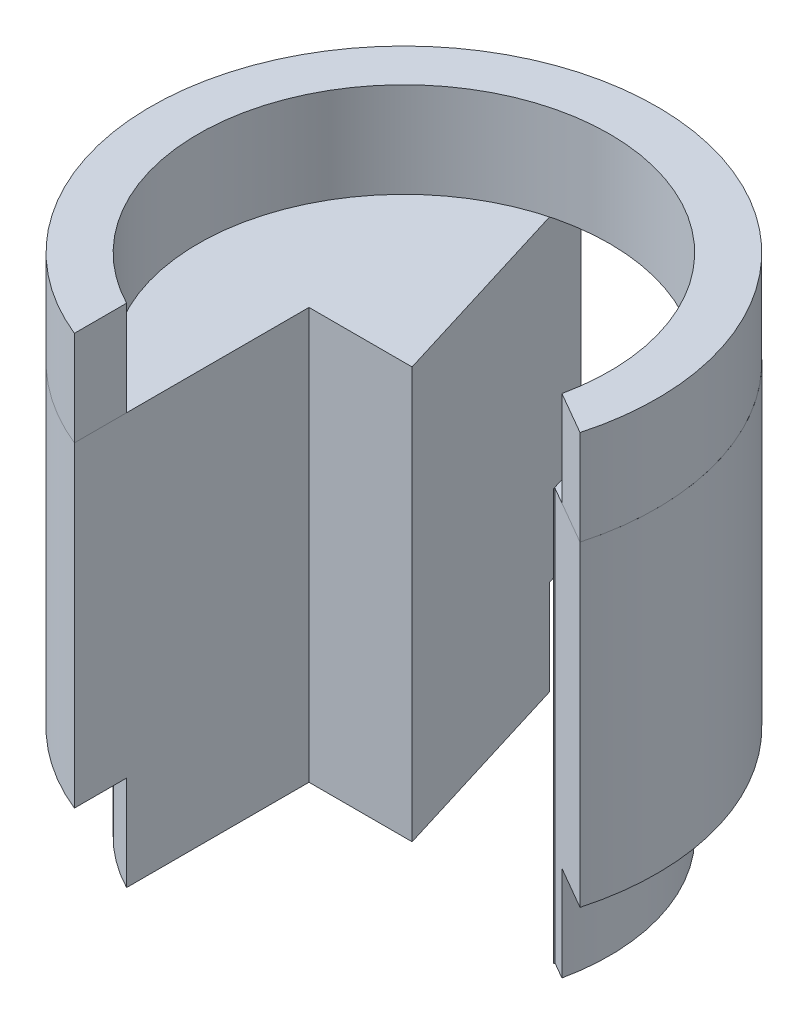
from build123d import *

# Parameters (mm, degrees)
SKETCH2_R               = 101.6
BOSS_EXTRUDE1_DEPTH     = 304.8
SKETCH3_R               = 101.6
SKETCH3_R_2             = 82.55
BOSS_EXTRUDE2_DEPTH     = 38.1
SKETCH4_W               = 76.2
SKETCH4_H               = 101.6
CUT_EXTRUDE1_DEPTH      = 228.6
CUT_EXTRUDE2_START      = -228.6
CUT_EXTRUDE2_DEPTH      = 190.5
SKETCH5_R               = 76.2
CUT_EXTRUDE3_DEPTH      = 25.4
CUT_EXTRUDE4_START      = -228.6
CUT_EXTRUDE4_DEPTH      = 228.6
CUT_EXTRUDE5_DEPTH      = 372.786941675
CUT_EXTRUDE6_DEPTH      = 372.786941675
CUT_EXTRUDE6_DEPTH_BACK = 372.786941675
SKETCH8_W               = 203.2
SKETCH8_H               = 177.8
BOSS_EXTRUDE3_START     = -165.1
BOSS_EXTRUDE3_DEPTH     = 38.1
SHELL1_START            = 190.5
SHELL1_DEPTH            = 101.6
SHELL1_START_2          = 139.7
SHELL1_2_DEPTH          = 50.8


# Read off the part's stored shape, not the designer's step: Shell1
with BuildPart() as part:
    # Sketch2 → Boss-Extrude1 (new body)
    with BuildSketch(Plane(origin=(0, 0, 0), x_dir=(1, 0, 0), z_dir=(0, 1, 0))):
        with Locations(Location((0, 0, 0), (0, 0, 90))):
            Circle(SKETCH2_R)
    extrude(amount=BOSS_EXTRUDE1_DEPTH)


with BuildPart() as body_2:
    # Sketch3 → Boss-Extrude2 (new body)
    with BuildSketch(Plane(origin=(0, 304.8, 0), x_dir=(1, 0, 0), z_dir=(0, 1, 0))):
        with Locations(Location((0, 0, 0), (0, 0, 90))):
            Circle(SKETCH3_R)
        with Locations(Location((0, 0, 0), (0, 0, 90))):
            Circle(SKETCH3_R_2, mode=Mode.SUBTRACT)
    extrude(amount=BOSS_EXTRUDE2_DEPTH)


with BuildPart() as cut_extrude1_tool:
    # Sketch4 → Cut-Extrude1 (new body)
    with BuildSketch(Plane(origin=(0, 342.9, 0), x_dir=(1, 0, 0), z_dir=(0, 1, 0))):
        with Locations((0, -50.8)):
            Rectangle(SKETCH4_W, SKETCH4_H)
    extrude(amount=-CUT_EXTRUDE1_DEPTH)


with BuildPart() as part_1:
    add(part.part)

    # Cut-Extrude1: cut by cut_extrude1_tool
    add(cut_extrude1_tool.part, mode=Mode.SUBTRACT)

    # Sketch4<4> → Cut-Extrude2 (cut)
    with BuildSketch(Plane(origin=(0, 342.9, 0), x_dir=(1, 0, 0), z_dir=(0, 1, 0)).offset(CUT_EXTRUDE2_START)):
        with BuildLine():
            ThreePointArc((78.027556588, -26.94815231), (62.505565542, -53.92176533), (38.1, -73.231772476))
            Line((38.1, -73.231772476), (38.1, -94.185720786))
            ThreePointArc((38.1, -94.185720786), (65.394822961, -77.756524678), (86.259952515, -53.682218584))
            Line((86.259952515, -53.682218584), (78.027556588, -26.94815231))
        make_face()
        with BuildLine():
            Line((-21.27474203, 79.761443389), (3.286721048, 0))
            Line((3.286721048, 0), (38.1, 0))
            Line((38.1, 0), (38.1, -73.231772476))
            ThreePointArc((38.1, -73.231772476), (62.505565542, -53.92176533), (78.027556588, -26.94815231))
            Line((78.027556588, -26.94815231), (49.352145598, 66.173017347))
            ThreePointArc((49.352145598, 66.173017347), (15.596361061, 81.063284054), (-21.27474203, 79.761443389))
        make_face()
        with BuildLine():
            Line((-26.884440108, 97.978502132), (-21.27474203, 79.761443389))
            ThreePointArc((-21.27474203, 79.761443389), (15.596361061, 81.063284054), (49.352145598, 66.173017347))
            Line((49.352145598, 66.173017347), (41.119749671, 92.907083621))
            ThreePointArc((41.119749671, 92.907083621), (7.555847472, 101.318651634), (-26.884440108, 97.978502132))
        make_face()
    extrude(amount=CUT_EXTRUDE2_DEPTH, mode=Mode.SUBTRACT)

    # Sketch5 → Cut-Extrude3 (cut)
    with BuildSketch(Plane.XZ):
        with Locations(Location((0, 0, 0), (0, 0, 270))):
            Circle(SKETCH5_R)
    extrude(amount=-CUT_EXTRUDE3_DEPTH, mode=Mode.SUBTRACT)


with BuildPart() as body_2_1:
    add(body_2.part)

    # Cut-Extrude1: cut by cut_extrude1_tool
    add(cut_extrude1_tool.part, mode=Mode.SUBTRACT)


with BuildPart() as cut_extrude4_tool:
    # Sketch6 → Cut-Extrude4 (new body)
    with BuildSketch(Plane(origin=(0, 342.9, 0), x_dir=(1, 0, 0), z_dir=(0, 1, 0)).offset(CUT_EXTRUDE4_START)):
        Polygon((48.891726717, -57.557045256), (74.291726717, -13.562954744), (107.287294601, -32.612954744), (60.297294601, -114.002022192), (14.155449479, -87.362015489), (35.745449479, -49.967038554), align=None)
    extrude(amount=CUT_EXTRUDE4_DEPTH)


with BuildPart() as part_2:
    add(part_1.part)

    # Cut-Extrude4: cut by cut_extrude4_tool
    add(cut_extrude4_tool.part, mode=Mode.SUBTRACT)

    # Sketch6<4> → Cut-Extrude5 (cut, through all)
    with BuildSketch(Plane(origin=(0, 342.9, 0), x_dir=(1, 0, 0), z_dir=(0, 1, 0))):
        with BuildLine():
            ThreePointArc((97.894189943, -27.189843241), (87.988181024, -50.8), (72.494189943, -71.183933753))
            Line((72.494189943, -71.183933753), (81.887294601, -76.607045256))
            Line((81.887294601, -76.607045256), (107.287294601, -32.612954744))
            Line((107.287294601, -32.612954744), (97.894189943, -27.189843241))
        make_face()
        with BuildLine():
            ThreePointArc((80.722105782, -17.275535828), (71.490397082, -41.275), (55.322105782, -61.26962634))
            Line((55.322105782, -61.26962634), (72.494189943, -71.183933753))
            ThreePointArc((72.494189943, -71.183933753), (87.988181024, -50.8), (97.894189943, -27.189843241))
            Line((97.894189943, -27.189843241), (80.722105782, -17.275535828))
        make_face()
        with BuildLine():
            Line((74.291726717, -13.562954744), (48.891726717, -57.557045256))
            Line((48.891726717, -57.557045256), (55.322105782, -61.26962634))
            ThreePointArc((55.322105782, -61.26962634), (71.490397082, -41.275), (80.722105782, -17.275535828))
            Line((80.722105782, -17.275535828), (74.291726717, -13.562954744))
        make_face()
    extrude(amount=-CUT_EXTRUDE5_DEPTH, mode=Mode.SUBTRACT)

    # Sketch8 → Cut-Extrude6 (cut, two sides: drawn at the far end of the back side and taken through both)
    with BuildSketch(Plane.XY.offset(-CUT_EXTRUDE6_DEPTH_BACK)):
        with Locations((0, 88.9)):
            Rectangle(SKETCH8_W, SKETCH8_H)
    extrude(amount=CUT_EXTRUDE6_DEPTH + CUT_EXTRUDE6_DEPTH_BACK, mode=Mode.SUBTRACT)


with BuildPart() as body_2_2:
    add(body_2_1.part)

    # Cut-Extrude4: cut by cut_extrude4_tool
    add(cut_extrude4_tool.part, mode=Mode.SUBTRACT)


with BuildPart() as cut_extrude6_piece_1:
    # of the separate pieces the step leaves, piece 1, a body of its own (cut_extrude6_pieces)
    add(part_2.part.solids().sort_by_distance((-26.884440108, 177.8, -97.978502132))[0])



with BuildPart() as cut_extrude6_piece_2:
    # of the separate pieces the step leaves, piece 2, a body of its own (cut_extrude6_pieces)
    add(part_2.part.solids().sort_by_distance((41.119749671, 177.8, -92.907083621))[0])


with BuildPart() as cut_extrude6_piece_1_1:
    add(cut_extrude6_piece_1.part)

    add(cut_extrude6_piece_2.part)  # Boss-Extrude3 merges Cut-Extrude6 piece 2
    # Sketch7 → Boss-Extrude3 (add)
    with BuildSketch(Plane(origin=(0, 342.9, 0), x_dir=(1, 0, 0), z_dir=(0, 1, 0)).offset(BOSS_EXTRUDE3_START)):
        with BuildLine():
            Line((3.286721048, 0), (-21.27474203, 79.761443389))
            ThreePointArc((-21.27474203, 79.761443389), (-82.055292474, 9.023939106), (-38.1, -73.231772476))
            Line((-38.1, -73.231772476), (-38.1, 0))
            Line((-38.1, 0), (3.286721048, 0))
        make_face()
        with BuildLine():
            Line((74.291726717, -13.562954744), (80.722105782, -17.275535828))
            ThreePointArc((80.722105782, -17.275535828), (77.270582855, 29.047539056), (49.352145598, 66.173017347))
            Line((49.352145598, 66.173017347), (74.040017303, -13.998928238))
            Line((74.040017303, -13.998928238), (74.291726717, -13.562954744))
        make_face()
    extrude(amount=-BOSS_EXTRUDE3_DEPTH)

    # Shell1 outline → Shell1 (cut)
    with BuildSketch(Plane(origin=(0, 0, 0), x_dir=(1, 0, 0), z_dir=(0, 1, 0)).offset(SHELL1_START)):
        with BuildLine():
            ThreePointArc((-35.147015765, 81.657193699), (-88.447883477, 8.954435127), (-50.8, -72.955945611))
            Line((-50.8, -72.955945611), (-50.8, 12.7))
            Line((-50.8, 12.7), (-13.912575978, 12.7))
            Line((-13.912575978, 12.7), (-35.147015765, 81.657193699))
        make_face()
    extrude(amount=SHELL1_DEPTH, mode=Mode.SUBTRACT)

    # Shell1 2 outline → Shell1 2 (cut)
    with BuildSketch(Plane(origin=(0, 0, 0), x_dir=(1, 0, 0), z_dir=(0, 1, 0)).offset(SHELL1_START_2)):
        with BuildLine():
            ThreePointArc((-29.498901057, 63.315379936), (-68.603927404, 13.134825645), (-50.8, -47.941448664))
            Line((-50.8, -47.941448664), (-50.8, 12.7))
            Line((-50.8, 12.7), (-13.912575978, 12.7))
            Line((-13.912575978, 12.7), (-29.498901057, 63.315379936))
        make_face()
    extrude(amount=SHELL1_2_DEPTH, mode=Mode.SUBTRACT)


solid = Compound([body_2_2.part, cut_extrude6_piece_1_1.part])
